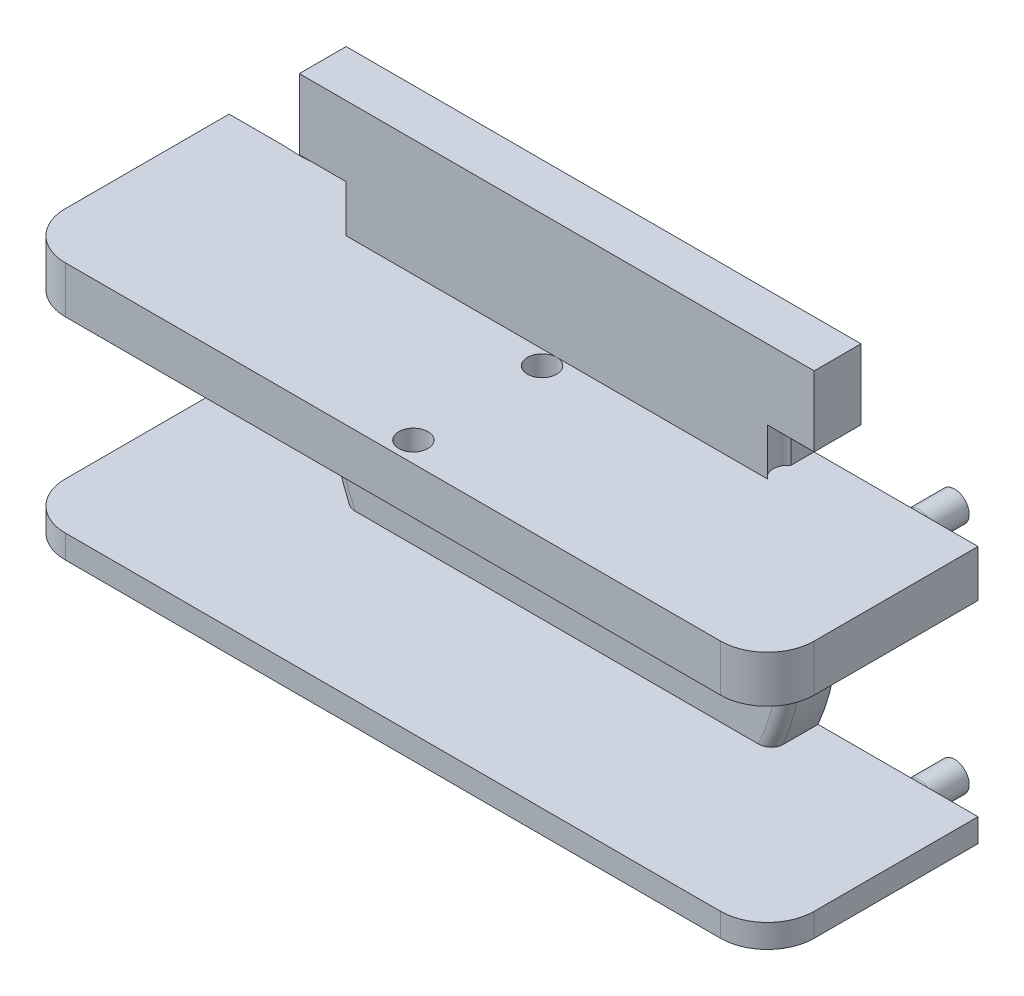
from build123d import *

# Parameters (mm, degrees)
BOSS_EXTRUDE1_DEPTH     = 2
SKETCH2_R               = 1.575
BOSS_EXTRUDE2_DEPTH     = 4
SKETCH3_R               = 1.8
BOSS_EXTRUDE3_DEPTH     = 0.75
SKETCH4_W               = 2
SKETCH4_H               = 17
BOSS_EXTRUDE4_DEPTH     = 0.001
SKETCH5_W               = 18
SKETCH5_H               = 2
BOSS_EXTRUDE5_DEPTH     = 0.001
SKETCH6_W               = 2.001
SKETCH6_H               = 2
BOSS_EXTRUDE6_DEPTH     = 5
BOSS_EXTRUDE7_DEPTH     = 0.001
CUT_EXTRUDE1_DEPTH      = 20.519323784
SKETCH9_W               = 2.937742252
SKETCH9_H               = 8
CUT_EXTRUDE2_DEPTH      = 0.001
CUT_EXTRUDE11_START     = -0.001
SKETCH21_R              = 9.75
SKETCH21_R_2            = 1.8
CUT_EXTRUDE11_DEPTH     = 0.001
SKETCH10_W              = 32
SKETCH10_H              = 2
BOSS_EXTRUDE8_DEPTH     = 7
FILLET1_R               = 0.5
SKETCH11_R              = 0.625
BOSS_EXTRUDE9_DEPTH     = 2
SKETCH14_W              = 2
SKETCH14_H              = 2
CUT_EXTRUDE5_DEPTH      = 22.401355237
SKETCH12_R              = 0.675
CUT_EXTRUDE3_DEPTH      = 2.5
CUT_EXTRUDE6_DEPTH      = 2
FILLET2_R               = 0.5
FILLET3_R               = 0.5
FILLET4_R               = 2
CUT_EXTRUDE7_DEPTH      = 26.019992106
CUT_EXTRUDE7_DEPTH_BACK = 1
SKETCH19_R              = 0.625
CUT_EXTRUDE9_DEPTH      = 2


with BuildPart() as part:
    # Sketch1 → Boss-Extrude1 (new body)
    with BuildSketch(Plane.XY):
        Polygon((-11, 6), (-11, 11), (11, 11), (11, 6), (11, -6), (-11, -6), align=None)
    extrude(amount=BOSS_EXTRUDE1_DEPTH)

    # Sketch3 → Boss-Extrude3 (add)
    with BuildSketch(Plane(origin=(0, 0, 0), x_dir=(-1, 0, 0), z_dir=(0, 0, -1))):
        with Locations(Location((0, 0, 0), (0, 0, 180))):
            Circle(SKETCH3_R)
    extrude(amount=BOSS_EXTRUDE3_DEPTH)

    # Sketch4 → Boss-Extrude4 (add)
    with BuildSketch(Plane(origin=(0, 0, 0), x_dir=(-1, 0, 0), z_dir=(0, 0, -1))):
        with Locations((10, 2.5)):
            Rectangle(SKETCH4_W, SKETCH4_H)
        with Locations((-10, 2.5)):
            Rectangle(SKETCH4_W, SKETCH4_H)
    extrude(amount=BOSS_EXTRUDE4_DEPTH)

    # Sketch5 → Boss-Extrude5 (add)
    with BuildSketch(Plane(origin=(0, 0, 0), x_dir=(-1, 0, 0), z_dir=(0, 0, -1))):
        with Locations((0, 10)):
            Rectangle(SKETCH5_W, SKETCH5_H)
    extrude(amount=BOSS_EXTRUDE5_DEPTH)

    # Sketch6 → Boss-Extrude6 (add)
    with BuildSketch(Plane(origin=(11, 0, 0), x_dir=(0, 0, -1), z_dir=(1, 0, 0))):
        with Locations((-0.9995, -5)):
            Rectangle(SKETCH6_W, SKETCH6_H)
        with Locations((-0.9995, 5)):
            Rectangle(SKETCH6_W, SKETCH6_H)
    boss_extrude6 = extrude(amount=BOSS_EXTRUDE6_DEPTH)

    # Mirror1: Boss-Extrude6 across plane
    add(boss_extrude6.mirror(Plane(origin=(0, 0, 0), x_dir=(0, 0, 1), z_dir=(1, 0, 0))))

    # Sketch7 → Boss-Extrude7 (add)
    with BuildSketch(Plane(origin=(0, 0, -0.001), x_dir=(-1, 0, 0), z_dir=(0, 0, -1))):
        with BuildLine():
            ThreePointArc((-6.708203932, -6), (-8.407551231, -3.211398808), (-9, 0))
            Line((-9, 0), (-9, -6))
            Line((-9, -6), (-6.708203932, -6))
        make_face()
        with BuildLine():
            Line((-9, 9), (-9, 0))
            ThreePointArc((-9, 0), (-6.363961031, 6.363961031), (0, 9))
            Line((0, 9), (-9, 9))
        make_face()
    boss_extrude7 = extrude(amount=-BOSS_EXTRUDE7_DEPTH)

    # Sketch8 → Cut-Extrude1 (cut, through all)
    with BuildSketch(Plane(origin=(0, 0, -0.001), x_dir=(-1, 0, 0), z_dir=(0, 0, -1))):
        with BuildLine():
            Line((-11, 4), (-9.16515139, 4))
            ThreePointArc((-9.16515139, 4), (-10, 0), (-9.16515139, -4))
            Line((-9.16515139, -4), (-11, -4))
            Line((-11, -4), (-11, 4))
        make_face()
    cut_extrude1 = extrude(amount=-CUT_EXTRUDE1_DEPTH, mode=Mode.SUBTRACT)

    # Sketch9 → Cut-Extrude2 (cut)
    with BuildSketch(Plane(origin=(0, 0, -0.001), x_dir=(-1, 0, 0), z_dir=(0, 0, -1))):
        with Locations((-9.531128874, 0)):
            Rectangle(SKETCH9_W, SKETCH9_H)
    cut_extrude2 = extrude(amount=-CUT_EXTRUDE2_DEPTH, mode=Mode.SUBTRACT)

    # Mirror2: Boss-Extrude7, Cut-Extrude1, Cut-Extrude2 across plane
    add(boss_extrude7.mirror(Plane(origin=(0, 0, 0), x_dir=(0, 0, 1), z_dir=(1, 0, 0))))
    add(cut_extrude1.mirror(Plane(origin=(0, 0, 0), x_dir=(0, 0, 1), z_dir=(1, 0, 0))), mode=Mode.SUBTRACT)
    add(cut_extrude2.mirror(Plane(origin=(0, 0, 0), x_dir=(0, 0, 1), z_dir=(1, 0, 0))), mode=Mode.SUBTRACT)

    # Sketch21 → Cut-Extrude11 (cut)
    with BuildSketch(Plane(origin=(0, 0, -0.001), x_dir=(-1, 0, 0), z_dir=(0, 0, -1)).offset(CUT_EXTRUDE11_START)):
        Circle(SKETCH21_R)
        with Locations(Location((0, 0, 0), (0, 0, 180))):
            Circle(SKETCH21_R_2, mode=Mode.SUBTRACT)
    extrude(amount=CUT_EXTRUDE11_DEPTH, mode=Mode.SUBTRACT)

    # Sketch10 → Boss-Extrude8 (add)
    with BuildSketch(Plane.XY.offset(2)):
        with Locations((0, -5)):
            Rectangle(SKETCH10_W, SKETCH10_H)
        with Locations((0, 5)):
            Rectangle(SKETCH10_W, SKETCH10_H)
    extrude(amount=BOSS_EXTRUDE8_DEPTH)

    # Fillet1
    fillet1_edges = [part.edges().sort_by_distance(p)[0] for p in [
        (10, 0, 2),
        (-10, 0, 2),
    ]]
    fillet(fillet1_edges, radius=FILLET1_R)

    # Sketch11 → Boss-Extrude9 (add)
    with BuildSketch(Plane(origin=(0, 0, -0.001), x_dir=(-1, 0, 0), z_dir=(0, 0, -1))):
        with Locations(Location((-13, -5, 0), (0, 0, 180))):
            Circle(SKETCH11_R)
    boss_extrude9 = extrude(amount=BOSS_EXTRUDE9_DEPTH)

    # Sketch14 → Cut-Extrude5 (cut, through all)
    with BuildSketch(Plane(origin=(0, 0, -0.001), x_dir=(-1, 0, 0), z_dir=(0, 0, -1))):
        with Locations((10, 7)):
            Rectangle(SKETCH14_W, SKETCH14_H)
        with Locations((-10, 7)):
            Rectangle(SKETCH14_W, SKETCH14_H)
    extrude(amount=-CUT_EXTRUDE5_DEPTH, mode=Mode.SUBTRACT)

    # Sketch12 → Cut-Extrude3 (cut)
    with BuildSketch(Plane(origin=(0, 0, -0.001), x_dir=(-1, 0, 0), z_dir=(0, 0, -1))):
        with Locations((13, -5)):
            Circle(SKETCH12_R)
    cut_extrude3 = extrude(amount=-CUT_EXTRUDE3_DEPTH, mode=Mode.SUBTRACT)

    # Sketch16 → Cut-Extrude6 (cut)
    with BuildSketch(Plane(origin=(0, 6, 0), x_dir=(1, 0, 0), z_dir=(0, 1, 0))):
        with BuildLine():
            Line((-9, -1), (-9, -2))
            ThreePointArc((-9, -2), (-8.75, -1.5), (-9, -1))
        make_face()
    cut_extrude6 = extrude(amount=CUT_EXTRUDE6_DEPTH, mode=Mode.SUBTRACT)

    # Mirror3: Boss-Extrude9, Cut-Extrude3 across plane
    add(boss_extrude9.mirror(Plane.ZX))
    add(cut_extrude3.mirror(Plane.ZX), mode=Mode.SUBTRACT)

    # Mirror4: Cut-Extrude6 across plane
    add(cut_extrude6.mirror(Plane(origin=(0, 0, 0), x_dir=(0, 0, 1), z_dir=(1, 0, 0))), mode=Mode.SUBTRACT)

    # Fillet2
    fillet2_edges = [part.edges().sort_by_distance(p)[0] for p in [
        (12.375, -5, -0.001),
        (12.375, 5, -0.001),
    ]]
    fillet(fillet2_edges, radius=FILLET2_R)

    # Fillet3
    # the kernel refuses this fillet: 0.5 mm, written as the material it takes off along each edge
    with BuildSketch(Plane(origin=(-13, -5, -0.001), x_dir=(-1, 0, 0), z_dir=(0, -1, 0))) as fillet3_piece_1:
        with BuildLine():
            CenterArc((0.675 + FILLET3_R, -FILLET3_R), FILLET3_R, 90, 90)
            Line((0.675, -FILLET3_R), (0.675, 0))
            Line((0.675, 0), (0.675 + FILLET3_R, 0))
        make_face()
    revolve(axis=Axis((-13, -5, -0.001), (0, 0, -1)), mode=Mode.SUBTRACT)
    with BuildSketch(Plane(origin=(-13, 5, -0.001), x_dir=(-1, 0, 0), z_dir=(0, 1, 0))) as fillet3_piece_2:
        with BuildLine():
            CenterArc((0.675 + FILLET3_R, FILLET3_R), FILLET3_R, 180, 90)
            Line((0.675, FILLET3_R), (0.675, 0))
            Line((0.675, 0), (0.675 + FILLET3_R, 0))
        make_face()
    revolve(axis=Axis((-13, 5, -0.001), (0, 0, 1)), mode=Mode.SUBTRACT)

    # Fillet4
    fillet4_edges = [part.edges().sort_by_distance(p)[0] for p in [
        (16, -5, 9),
        (-16, -5, 9),
        (-16, 5, 9),
        (16, 5, 9),
    ]]
    fillet(fillet4_edges, radius=FILLET4_R)

    # Sketch17 → Cut-Extrude7 (cut, two sides: drawn at the far end of the back side and taken through both)
    with BuildSketch(Plane.XZ.offset(6).offset(-CUT_EXTRUDE7_DEPTH_BACK)):
        with BuildLine():
            Line((-16, 7), (-16, -0.001))
            Line((-16, -0.001), (-14.5, -0.001))
            Line((-14.5, -0.001), (-14.5, 7))
            ThreePointArc((-14.5, 7), (-14.353553391, 7.353553391), (-14, 7.5))
            Line((-14, 7.5), (14, 7.5))
            ThreePointArc((14, 7.5), (14.353553391, 7.353553391), (14.5, 7))
            Line((14.5, 7), (14.5, -0.001))
            Line((14.5, -0.001), (16, -0.001))
            Line((16, -0.001), (16, 7))
            ThreePointArc((16, 7), (15.414213562, 8.414213562), (14, 9))
            Line((14, 9), (-14, 9))
            ThreePointArc((-14, 9), (-15.414213562, 8.414213562), (-16, 7))
        make_face()
    extrude(amount=CUT_EXTRUDE7_DEPTH + CUT_EXTRUDE7_DEPTH_BACK, mode=Mode.SUBTRACT)

    # Sketch19 → Cut-Extrude9 (cut)
    with BuildSketch(Plane(origin=(0, 6, 0), x_dir=(1, 0, 0), z_dir=(0, 1, 0))):
        with Locations(Location((0, -2.625, 0), (0, 0, 90))):
            Circle(SKETCH19_R)
        with Locations(Location((0, -8.125, 0), (0, 0, 270))):
            Circle(SKETCH19_R)
    extrude(amount=-CUT_EXTRUDE9_DEPTH, mode=Mode.SUBTRACT)


with BuildPart() as body_2:
    # Sketch2 → Boss-Extrude2 (new body)
    with BuildSketch(Plane(origin=(0, 0, 2), x_dir=(-1, 0, 0), z_dir=(0, 0, -1))):
        Circle(SKETCH2_R)
    extrude(amount=BOSS_EXTRUDE2_DEPTH)


with BuildPart() as part_1:
    add(part.part)

    # Combine2: cut body 2
    add(body_2.part, mode=Mode.SUBTRACT)


solid = part_1.part
